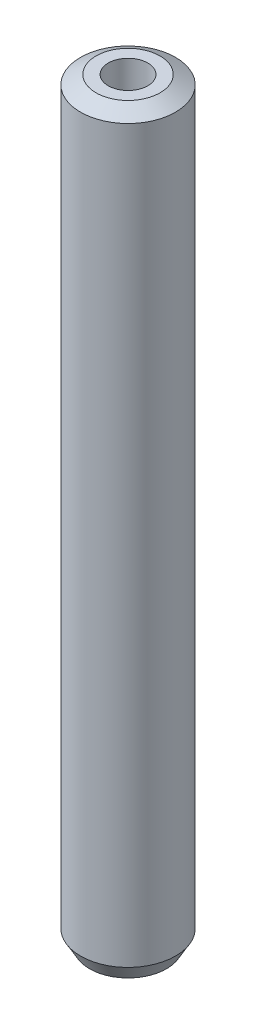
from build123d import *
from OCP.BRepFilletAPI import BRepFilletAPI_MakeChamfer

# Parameters (mm, degrees)
SKETCH1_R           = 15
BOSS_EXTRUDE1_DEPTH = 238.493673998
SKETCH2_R           = 6.243747491
CUT_EXTRUDE1_DEPTH  = 240.435236623
CHAMFER1_SIZE       = 2.831705061
CHAMFER1_SIZE2      = 4.904657037


with BuildPart() as part:
    # Sketch1 → Boss-Extrude1 (new body)
    with BuildSketch(Plane(origin=(0, 0, 0), x_dir=(1, 0, 0), z_dir=(0, 1, 0))):
        Circle(SKETCH1_R)
    extrude(amount=BOSS_EXTRUDE1_DEPTH)

    # Sketch2 → Cut-Extrude1 (cut, through all)
    with BuildSketch(Plane(origin=(0, 0, 0), x_dir=(1, 0, 0), z_dir=(0, 1, 0))):
        Circle(SKETCH2_R)
    extrude(amount=CUT_EXTRUDE1_DEPTH, mode=Mode.SUBTRACT)

    # Chamfer1: one chamfer whose edges measure the first distance from different faces: ONE call of the kernel's chamfer builder (chamfer() names one face for all edges)
    chamfer1_edges_1 = [part.edges().sort_by_distance(p)[0] for p in [
        (-15, 238.493673998, 0),
    ]]
    chamfer1_side_1 = [part.faces().sort_by_distance(p)[0] for p in [
        (-15, 119.246836999, 0),
    ]]
    chamfer1_edges_2 = [part.edges().sort_by_distance(p)[0] for p in [
        (-15, 0, 0),
    ]]
    chamfer1_side_2 = [part.faces().sort_by_distance(p)[0] for p in [
        (-14.575735931, 0, 0),
    ]]
    chamfer1 = BRepFilletAPI_MakeChamfer(part.part.solid().wrapped)
    for e in chamfer1_edges_1:
        chamfer1.Add(CHAMFER1_SIZE, CHAMFER1_SIZE2, e.wrapped, chamfer1_side_1[0].wrapped)  # the first distance lies on this face
    for e in chamfer1_edges_2:
        chamfer1.Add(CHAMFER1_SIZE, CHAMFER1_SIZE2, e.wrapped, chamfer1_side_2[0].wrapped)  # the first distance lies on this face
    add(Compound.cast(chamfer1.Shape()), mode=Mode.REPLACE)


solid = part.part
